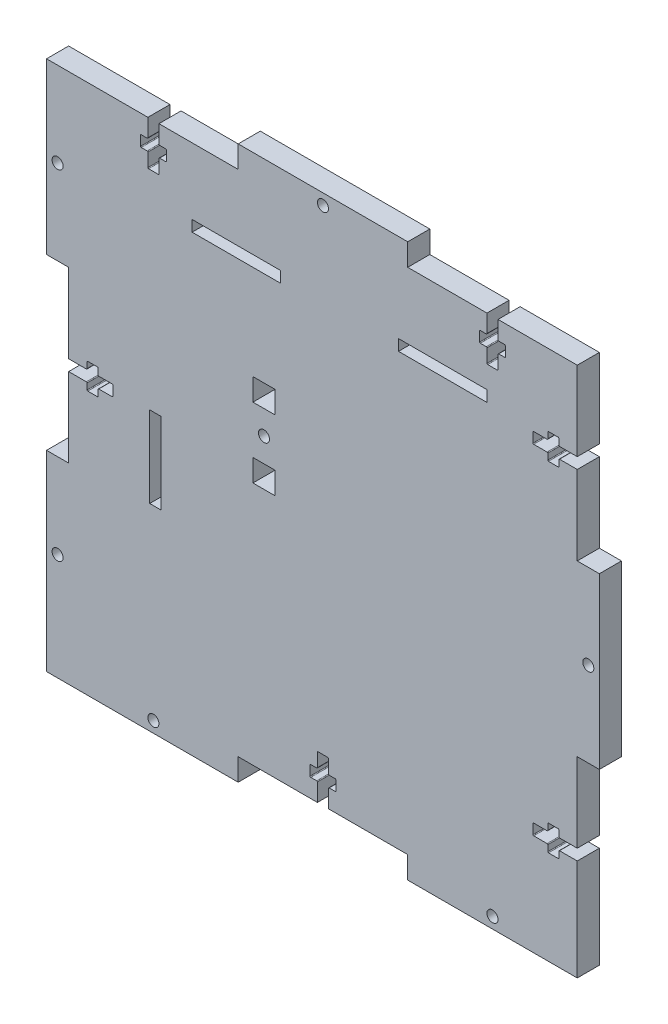
from build123d import *

# Parameters (mm, degrees)
BOX_SIDE_DEPTH       = 6
SKETCH2_R            = 1.5
SCREW_CUT_OUTS_DEPTH = 107.235587258
SKETCH3_R            = 1.5
SKETCH3_W            = 24
SKETCH3_H            = 3
SKETCH3_W_2          = 6
SKETCH3_H_2          = 6
SKETCH3_W_3          = 3
SKETCH3_H_3          = 22
GROOVES_DEPTH        = 107.235587258


with BuildPart() as part:
    # Sketch1 → Box Side (new body)
    with BuildSketch(Plane.XY):
        Polygon((-69, 69), (-23, 69), (-23, 75), (23, 75), (23, 69), (69, 69), (69, 23), (75, 23), (75, -23), (69, -23), (69, -69), (69, -75), (23, -75), (23, -69), (-23, -69), (-23, -75), (-69, -75), (-75, -75), (-75, -69), (-75, -23), (-69, -23), (-69, 23), (-75, 23), (-75, 69), align=None)
    extrude(amount=BOX_SIDE_DEPTH)

    # Sketch2 → Screw Cut-outs (cut, through all)
    with BuildSketch(Plane.XY.offset(6)):
        with Locations((0, 72)):
            Circle(SKETCH2_R)
        with Locations((72, 0)):
            Circle(SKETCH2_R)
        with Locations((-46, -72)):
            Circle(SKETCH2_R)
        with Locations((46, -72)):
            Circle(SKETCH2_R)
        with Locations((-72, 46)):
            Circle(SKETCH2_R)
        with Locations((-72, -46)):
            Circle(SKETCH2_R)
        with BuildLine():
            Line((-44.5, 69), (-44.5, 64.2))
            ThreePointArc((-44.5, 64.2), (-44.441421356, 64.058578644), (-44.3, 64))
            Line((-44.3, 64), (-42.7, 64))
            ThreePointArc((-42.7, 64), (-42.558578644, 63.941421356), (-42.5, 63.8))
            Line((-42.5, 63.8), (-42.5, 61.2))
            ThreePointArc((-42.5, 61.2), (-42.558578644, 61.058578644), (-42.7, 61))
            Line((-42.7, 61), (-44.3, 61))
            ThreePointArc((-44.3, 61), (-44.441421356, 60.941421356), (-44.5, 60.8))
            Line((-44.5, 60.8), (-44.5, 57.2))
            ThreePointArc((-44.5, 57.2), (-44.558578644, 57.058578644), (-44.7, 57))
            Line((-44.7, 57), (-47.3, 57))
            ThreePointArc((-47.3, 57), (-47.441421356, 57.058578644), (-47.5, 57.2))
            Line((-47.5, 57.2), (-47.5, 60.8))
            ThreePointArc((-47.5, 60.8), (-47.558578644, 60.941421356), (-47.7, 61))
            Line((-47.7, 61), (-49.3, 61))
            ThreePointArc((-49.3, 61), (-49.441421356, 61.058578644), (-49.5, 61.2))
            Line((-49.5, 61.2), (-49.5, 63.8))
            ThreePointArc((-49.5, 63.8), (-49.441421356, 63.941421356), (-49.3, 64))
            Line((-49.3, 64), (-47.7, 64))
            ThreePointArc((-47.7, 64), (-47.558578644, 64.058578644), (-47.5, 64.2))
            Line((-47.5, 64.2), (-47.5, 69))
            Line((-47.5, 69), (-44.5, 69))
        make_face()
        with BuildLine():
            Line((47.5, 69), (47.5, 64.2))
            ThreePointArc((47.5, 64.2), (47.558578644, 64.058578644), (47.7, 64))
            Line((47.7, 64), (49.3, 64))
            ThreePointArc((49.3, 64), (49.441421356, 63.941421356), (49.5, 63.8))
            Line((49.5, 63.8), (49.5, 61.2))
            ThreePointArc((49.5, 61.2), (49.441421356, 61.058578644), (49.3, 61))
            Line((49.3, 61), (47.7, 61))
            ThreePointArc((47.7, 61), (47.558578644, 60.941421356), (47.5, 60.8))
            Line((47.5, 60.8), (47.5, 57.2))
            ThreePointArc((47.5, 57.2), (47.441421356, 57.058578644), (47.3, 57))
            Line((47.3, 57), (44.7, 57))
            ThreePointArc((44.7, 57), (44.558578644, 57.058578644), (44.5, 57.2))
            Line((44.5, 57.2), (44.5, 60.8))
            ThreePointArc((44.5, 60.8), (44.441421356, 60.941421356), (44.3, 61))
            Line((44.3, 61), (42.7, 61))
            ThreePointArc((42.7, 61), (42.558578644, 61.058578644), (42.5, 61.2))
            Line((42.5, 61.2), (42.5, 63.8))
            ThreePointArc((42.5, 63.8), (42.558578644, 63.941421356), (42.7, 64))
            Line((42.7, 64), (44.3, 64))
            ThreePointArc((44.3, 64), (44.441421356, 64.058578644), (44.5, 64.2))
            Line((44.5, 64.2), (44.5, 69))
            Line((44.5, 69), (47.5, 69))
        make_face()
        with BuildLine():
            Line((69, 44.5), (64.2, 44.5))
            ThreePointArc((64.2, 44.5), (64.058578644, 44.441421356), (64, 44.3))
            Line((64, 44.3), (64, 42.7))
            ThreePointArc((64, 42.7), (63.941421356, 42.558578644), (63.8, 42.5))
            Line((63.8, 42.5), (61.2, 42.5))
            ThreePointArc((61.2, 42.5), (61.058578644, 42.558578644), (61, 42.7))
            Line((61, 42.7), (61, 44.3))
            ThreePointArc((61, 44.3), (60.941421356, 44.441421356), (60.8, 44.5))
            Line((60.8, 44.5), (57.2, 44.5))
            ThreePointArc((57.2, 44.5), (57.058578644, 44.558578644), (57, 44.7))
            Line((57, 44.7), (57, 47.3))
            ThreePointArc((57, 47.3), (57.058578644, 47.441421356), (57.2, 47.5))
            Line((57.2, 47.5), (60.8, 47.5))
            ThreePointArc((60.8, 47.5), (60.941421356, 47.558578644), (61, 47.7))
            Line((61, 47.7), (61, 49.3))
            ThreePointArc((61, 49.3), (61.058578644, 49.441421356), (61.2, 49.5))
            Line((61.2, 49.5), (63.8, 49.5))
            ThreePointArc((63.8, 49.5), (63.941421356, 49.441421356), (64, 49.3))
            Line((64, 49.3), (64, 47.7))
            ThreePointArc((64, 47.7), (64.058578644, 47.558578644), (64.2, 47.5))
            Line((64.2, 47.5), (69, 47.5))
            Line((69, 47.5), (69, 44.5))
        make_face()
        with BuildLine():
            Line((69, -47.5), (64.2, -47.5))
            ThreePointArc((64.2, -47.5), (64.058578644, -47.558578644), (64, -47.7))
            Line((64, -47.7), (64, -49.3))
            ThreePointArc((64, -49.3), (63.941421356, -49.441421356), (63.8, -49.5))
            Line((63.8, -49.5), (61.2, -49.5))
            ThreePointArc((61.2, -49.5), (61.058578644, -49.441421356), (61, -49.3))
            Line((61, -49.3), (61, -47.7))
            ThreePointArc((61, -47.7), (60.941421356, -47.558578644), (60.8, -47.5))
            Line((60.8, -47.5), (57.2, -47.5))
            ThreePointArc((57.2, -47.5), (57.058578644, -47.441421356), (57, -47.3))
            Line((57, -47.3), (57, -44.7))
            ThreePointArc((57, -44.7), (57.058578644, -44.558578644), (57.2, -44.5))
            Line((57.2, -44.5), (60.8, -44.5))
            ThreePointArc((60.8, -44.5), (60.941421356, -44.441421356), (61, -44.3))
            Line((61, -44.3), (61, -42.7))
            ThreePointArc((61, -42.7), (61.058578644, -42.558578644), (61.2, -42.5))
            Line((61.2, -42.5), (63.8, -42.5))
            ThreePointArc((63.8, -42.5), (63.941421356, -42.558578644), (64, -42.7))
            Line((64, -42.7), (64, -44.3))
            ThreePointArc((64, -44.3), (64.058578644, -44.441421356), (64.2, -44.5))
            Line((64.2, -44.5), (69, -44.5))
            Line((69, -44.5), (69, -47.5))
        make_face()
        with BuildLine():
            Line((-1.5, -69), (1.5, -69))
            Line((1.5, -69), (1.5, -64.2))
            ThreePointArc((1.5, -64.2), (1.558578644, -64.058578644), (1.7, -64))
            Line((1.7, -64), (3.3, -64))
            ThreePointArc((3.3, -64), (3.441421356, -63.941421356), (3.5, -63.8))
            Line((3.5, -63.8), (3.5, -61.2))
            ThreePointArc((3.5, -61.2), (3.441421356, -61.058578644), (3.3, -61))
            Line((3.3, -61), (1.7, -61))
            ThreePointArc((1.7, -61), (1.558578644, -60.941421356), (1.5, -60.8))
            Line((1.5, -60.8), (1.5, -57.2))
            ThreePointArc((1.5, -57.2), (1.441421356, -57.058578644), (1.3, -57))
            Line((1.3, -57), (-1.3, -57))
            ThreePointArc((-1.3, -57), (-1.441421356, -57.058578644), (-1.5, -57.2))
            Line((-1.5, -57.2), (-1.5, -60.8))
            ThreePointArc((-1.5, -60.8), (-1.558578644, -60.941421356), (-1.7, -61))
            Line((-1.7, -61), (-3.3, -61))
            ThreePointArc((-3.3, -61), (-3.441421356, -61.058578644), (-3.5, -61.2))
            Line((-3.5, -61.2), (-3.5, -63.8))
            ThreePointArc((-3.5, -63.8), (-3.441421356, -63.941421356), (-3.3, -64))
            Line((-3.3, -64), (-1.7, -64))
            ThreePointArc((-1.7, -64), (-1.558578644, -64.058578644), (-1.5, -64.2))
            Line((-1.5, -64.2), (-1.5, -69))
        make_face()
        with BuildLine():
            Line((-69, -1.5), (-64.2, -1.5))
            ThreePointArc((-64.2, -1.5), (-64.058578644, -1.558578644), (-64, -1.7))
            Line((-64, -1.7), (-64, -3.3))
            ThreePointArc((-64, -3.3), (-63.941421356, -3.441421356), (-63.8, -3.5))
            Line((-63.8, -3.5), (-61.2, -3.5))
            ThreePointArc((-61.2, -3.5), (-61.058578644, -3.441421356), (-61, -3.3))
            Line((-61, -3.3), (-61, -1.7))
            ThreePointArc((-61, -1.7), (-60.941421356, -1.558578644), (-60.8, -1.5))
            Line((-60.8, -1.5), (-57.2, -1.5))
            ThreePointArc((-57.2, -1.5), (-57.058578644, -1.441421356), (-57, -1.3))
            Line((-57, -1.3), (-57, 1.3))
            ThreePointArc((-57, 1.3), (-57.058578644, 1.441421356), (-57.2, 1.5))
            Line((-57.2, 1.5), (-60.8, 1.5))
            ThreePointArc((-60.8, 1.5), (-60.941421356, 1.558578644), (-61, 1.7))
            Line((-61, 1.7), (-61, 3.3))
            ThreePointArc((-61, 3.3), (-61.058578644, 3.441421356), (-61.2, 3.5))
            Line((-61.2, 3.5), (-63.8, 3.5))
            ThreePointArc((-63.8, 3.5), (-63.941421356, 3.441421356), (-64, 3.3))
            Line((-64, 3.3), (-64, 1.7))
            ThreePointArc((-64, 1.7), (-64.058578644, 1.558578644), (-64.2, 1.5))
            Line((-64.2, 1.5), (-69, 1.5))
            Line((-69, 1.5), (-69, -1.5))
        make_face()
    extrude(amount=-SCREW_CUT_OUTS_DEPTH, mode=Mode.SUBTRACT)

    # Sketch3 → Grooves (cut, through all)
    with BuildSketch(Plane.XY.offset(6)):
        with Locations((-16, 9.82)):
            Circle(SKETCH3_R)
        with Locations((32.5, 49.5)):
            Rectangle(SKETCH3_W, SKETCH3_H)
        with Locations((-16, 19.32)):
            Rectangle(SKETCH3_W_2, SKETCH3_H_2)
        with Locations((-16, 0.32)):
            Rectangle(SKETCH3_W_2, SKETCH3_H_2)
        with Locations((-23.5, 49.5)):
            Rectangle(SKETCH3_W, SKETCH3_H)
        with Locations((-45.5, -10.5)):
            Rectangle(SKETCH3_W_3, SKETCH3_H_3)
    extrude(amount=-GROOVES_DEPTH, mode=Mode.SUBTRACT)


solid = part.part
